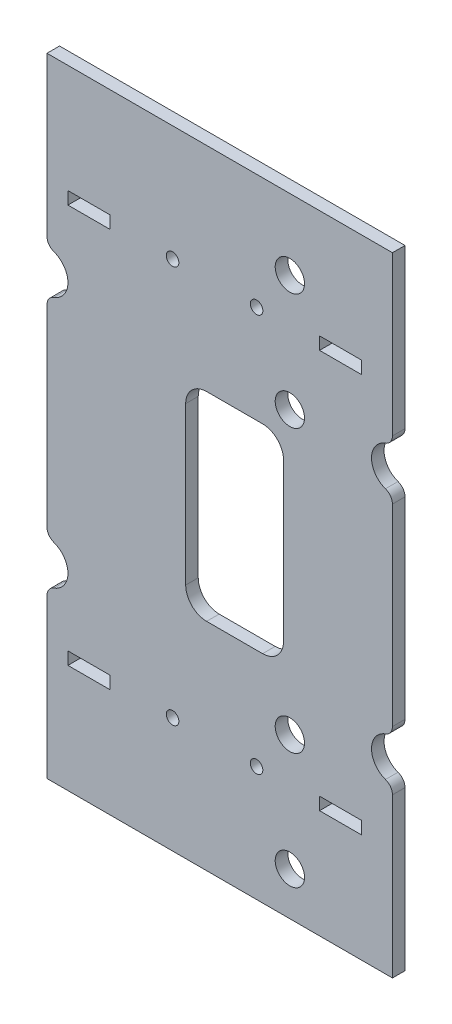
from build123d import *

# Parameters (mm, degrees)
SALIENTE_EXTRUIR1_START = -1.5
SALIENTE_EXTRUIR1_DEPTH = 3
CROQUIS4_W              = 23.371648172
CROQUIS4_H              = 47.52448784
CORTAR_EXTRUIR3_DEPTH   = 10
CROQUIS5_W              = 9.999999994
CROQUIS5_H              = 3
CROQUIS5_W_2            = 9.999999993
CORTAR_EXTRUIR4_DEPTH   = 10
CROQUIS6_R              = 1.5
CROQUIS6_R_2            = 3.5
CORTAR_EXTRUIR5_DEPTH   = 10
REDONDEO1_R             = 5


# Read off the part's stored shape, not the designer's step: Saliente-Extruir1
with BuildPart() as part:
    # Saliente-Extruir1 outline → Saliente-Extruir1 (new body)
    with BuildSketch(Plane.XY.offset(SALIENTE_EXTRUIR1_START)):
        with BuildLine():
            ThreePointArc((492.916449572, 98.009593947), (492.452410006, 99.442022929), (491.249851225, 100.348134338))
            ThreePointArc((491.249851225, 100.348134338), (487.916517891, 105.062179546), (491.249851225, 109.776224754))
            ThreePointArc((491.249851225, 109.776224754), (492.452037009, 110.681812922), (492.916439741, 112.113480025))
            Line((492.916439741, 112.113480025), (492.916413331, 149.999679341))
            Line((492.916413331, 149.999679341), (410.416517891, 149.999679341))
            Line((410.416517891, 149.999679341), (410.416517891, 112.133247358))
            ThreePointArc((410.416517891, 112.133247358), (410.875276439, 110.689871685), (412.083184558, 109.776224754))
            ThreePointArc((412.083184558, 109.776224754), (415.416517891, 105.062179546), (412.083184558, 100.348134338))
            ThreePointArc((412.083184558, 100.348134338), (410.875276439, 99.434487407), (410.416517891, 97.991111734))
            Line((410.416517891, 97.991111734), (410.416517891, 52.008362374))
            ThreePointArc((410.416517891, 52.008362374), (410.875276439, 50.564986701), (412.083184558, 49.65133977))
            ThreePointArc((412.083184558, 49.65133977), (415.416517891, 44.937294562), (412.083184558, 40.223249354))
            ThreePointArc((412.083184558, 40.223249354), (410.875276439, 39.309602423), (410.416517891, 37.86622675))
            Line((410.416517891, 37.86622675), (410.416517891, -0.000320659))
            Line((410.416517891, -0.000320659), (492.916517891, -0.000320659))
            Line((492.916517891, -0.000320659), (492.916491488, 37.877716604))
            ThreePointArc((492.916491488, 37.877716604), (492.45443711, 39.314289338), (491.249851225, 40.223249354))
            ThreePointArc((491.249851225, 40.223249354), (487.916517891, 44.937294562), (491.249851225, 49.65133977))
            ThreePointArc((491.249851225, 49.65133977), (492.453865854, 50.559496169), (492.916481647, 51.994900607))
            Line((492.916481647, 51.994900607), (492.916449572, 98.009593947))
        make_face()
    extrude(amount=SALIENTE_EXTRUIR1_DEPTH)

    # Croquis4 → Cortar-Extruir3 (cut)
    with BuildSketch(Plane.XY.offset(1.5)):
        with Locations((455.222459901, 75.336681949)):
            Rectangle(CROQUIS4_W, CROQUIS4_H)
    extrude(amount=-CORTAR_EXTRUIR3_DEPTH, mode=Mode.SUBTRACT)

    # Croquis5 → Cortar-Extruir4 (cut)
    with BuildSketch(Plane(origin=(0, 0, -1.5), x_dir=(-1, 0, 0), z_dir=(0, 0, -1))):
        with Locations((-420.416517885, 27.399679341)):
            Rectangle(CROQUIS5_W, CROQUIS5_H)
        with Locations((-480.50829052, 27.399679341)):
            Rectangle(CROQUIS5_W_2, CROQUIS5_H)
        with Locations((-480.50829052, 122.599679342)):
            Rectangle(CROQUIS5_W_2, CROQUIS5_H)
        with Locations((-420.416517885, 122.599679342)):
            Rectangle(CROQUIS5_W, CROQUIS5_H)
    extrude(amount=-CORTAR_EXTRUIR4_DEPTH, mode=Mode.SUBTRACT)

    # Croquis6 → Cortar-Extruir5 (cut)
    with BuildSketch(Plane.XY.offset(1.5)):
        with Locations((460.461664074, 27.503843939)):
            Circle(CROQUIS6_R)
        with Locations((440.404261852, 27.568711017)):
            Circle(CROQUIS6_R)
        with Locations((468.41649135, 38.074679341)):
            Circle(CROQUIS6_R_2)
        with Locations((468.416510711, 10.299679341)):
            Circle(CROQUIS6_R_2)
        with Locations((440.404261852, 122.435783537)):
            Circle(CROQUIS6_R)
        with Locations((460.461664074, 122.500650615)):
            Circle(CROQUIS6_R)
        with Locations((468.41649135, 133.074679341)):
            Circle(CROQUIS6_R_2)
        with Locations((468.416510711, 105.299679341)):
            Circle(CROQUIS6_R_2)
    extrude(amount=-CORTAR_EXTRUIR5_DEPTH, mode=Mode.SUBTRACT)

    # Redondeo1
    redondeo1_edges = [part.edges().sort_by_distance(p)[0] for p in [
        (466.908283987, 99.098925869, 0),
        (466.908283987, 51.574438029, 0),
        (443.536635815, 51.574438029, 0),
        (443.536635815, 99.098925869, 0),
    ]]
    fillet(redondeo1_edges, radius=REDONDEO1_R)


solid = part.part
